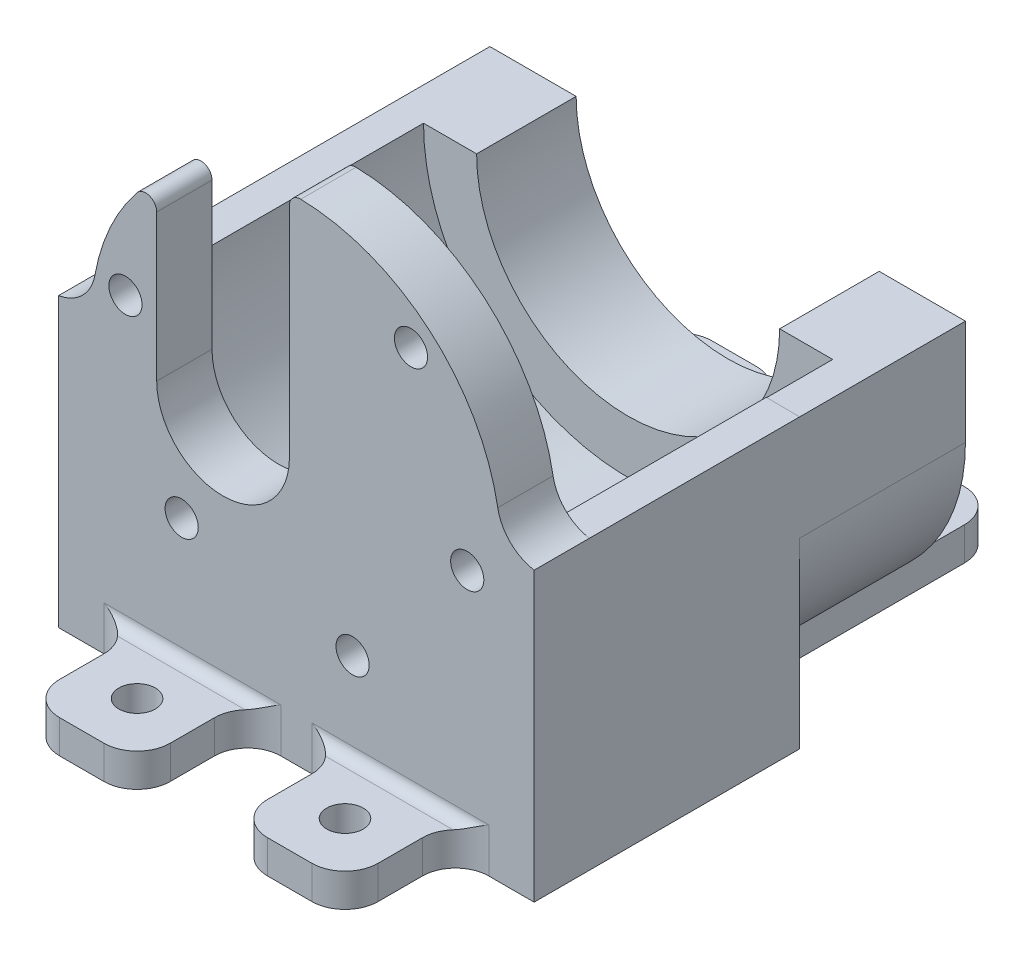
from build123d import *

# Parameters (mm, degrees)
BOSS_EXTRUDE1_DEPTH      = 9
BOSS_EXTRUDE2_DEPTH      = 25
FILLET1_R                = 16.5
BOSS_EXTRUDE3_START      = -34
SKETCH4_W                = 10
SKETCH4_H                = 3
BOSS_EXTRUDE3_DEPTH      = 44
SKETCH5_R                = 1.65
CUT_EXTRUDE1_DEPTH       = 3
FILLET2_R                = 3
SKETCH12_R               = 18.5
SKETCH12_R_2             = 1.5
SKETCH12_R_3             = 6
BOSS_EXTRUDE8_DEPTH      = 5
BOSS_EXTRUDE9_DEPTH      = 5
BOSS_EXTRUDE9_DEPTH_BACK = 19
SKETCH14_R               = 1.65
BOSS_EXTRUDE11_DEPTH     = 3
CUT_EXTRUDE2_START       = -6
CUT_EXTRUDE2_DEPTH       = 6
FILLET4_R                = 1
FILLET5_START            = -13
FILLET5_DEPTH            = 6
FILLET5_2_DEPTH          = 4
FILLET5_START_2          = -18
FILLET5_3_DEPTH          = 36
FILLET6_R                = 4


with BuildPart() as part:
    # Sketch1 → Boss-Extrude1 (new body)
    with BuildSketch(Plane.XY):
        with BuildLine():
            Line((13.7, 13), (21.5, 13))
            Line((21.5, 13), (21.5, -13))
            Line((21.5, -13), (-21.5, -13))
            Line((-21.5, -13), (-21.5, 13))
            Line((-21.5, 13), (-13.7, 13))
            ThreePointArc((-13.7, 13), (0, -0.7), (13.7, 13))
        make_face()
    extrude(amount=BOSS_EXTRUDE1_DEPTH)

    # Sketch2 → Boss-Extrude2 (add)
    with BuildSketch(Plane.XY.offset(9)):
        with BuildLine():
            Line((18.5, 13), (21.5, 13))
            Line((21.5, 13), (21.5, -13))
            Line((21.5, -13), (-21.5, -13))
            Line((-21.5, -13), (-21.5, 13))
            Line((-21.5, 13), (-18.5, 13))
            ThreePointArc((-18.5, 13), (0, -5.5), (18.5, 13))
        make_face()
    extrude(amount=BOSS_EXTRUDE2_DEPTH)

    # Fillet1
    fillet1_edges = [part.edges().sort_by_distance(p)[0] for p in [
        (21.5, -13, 17),
        (-21.5, -13, 17),
    ]]
    fillet(fillet1_edges, radius=FILLET1_R)

    # Sketch4 → Boss-Extrude3 (add)
    with BuildSketch(Plane(origin=(0, 0, 0), x_dir=(-1, 0, 0), z_dir=(0, 0, -1)).offset(BOSS_EXTRUDE3_START)):
        with Locations((-9.4, -11.5)):
            Rectangle(SKETCH4_W, SKETCH4_H)
        with Locations((9.4, -11.5)):
            Rectangle(SKETCH4_W, SKETCH4_H)
    extrude(amount=BOSS_EXTRUDE3_DEPTH)

    # Sketch5 → Cut-Extrude1 (cut)
    with BuildSketch(Plane(origin=(0, -10, 0), x_dir=(1, 0, 0), z_dir=(0, 1, 0))):
        with Locations(Location((9.4, 5, 0), (0, 0, 180))):
            Circle(SKETCH5_R)
        with Locations(Location((-9.4, 5, 0), (0, 0, 270))):
            Circle(SKETCH5_R)
    extrude(amount=-CUT_EXTRUDE1_DEPTH, mode=Mode.SUBTRACT)

    # Fillet2
    fillet2_edges = [part.edges().sort_by_distance(p)[0] for p in [
        (4.4, -11.5, 0),
        (9.4, -10, 0),
        (14.4, -11.5, -10),
        (4.4, -11.5, -10),
        (-9.4, -10, 0),
        (-4.4, -11.5, 0),
        (-14.4, -11.5, -10),
        (-4.4, -11.5, -10),
    ]]
    fillet(fillet2_edges, radius=FILLET2_R)



with BuildPart() as body_2:
    # Sketch12 → Boss-Extrude8 (new body)
    with BuildSketch(Plane.XY.offset(34)):
        with Locations((0, 13)):
            Circle(SKETCH12_R)
        with Locations((-15.451860729, 16.05)):
            Circle(SKETCH12_R_2, mode=Mode.SUBTRACT)
        with Locations((-5.084552883, 27.906703927)):
            Circle(SKETCH12_R_2, mode=Mode.SUBTRACT)
        with Locations((10.367307846, 24.856703927)):
            Circle(SKETCH12_R_2, mode=Mode.SUBTRACT)
        with Locations((15.451860729, 9.95)):
            Circle(SKETCH12_R_2, mode=Mode.SUBTRACT)
        with Locations((5.084552883, -1.906703927)):
            Circle(SKETCH12_R_2, mode=Mode.SUBTRACT)
        with Locations((-10.367307846, 1.143296073)):
            Circle(SKETCH12_R_2, mode=Mode.SUBTRACT)
        with Locations((-6.625133961, 10.74)):
            Circle(SKETCH12_R_3, mode=Mode.SUBTRACT)
    extrude(amount=BOSS_EXTRUDE8_DEPTH)


with BuildPart() as part_1:
    add(part.part)

    add(body_2.part)  # Boss-Extrude9 merges body 2
    # Sketch13 → Boss-Extrude9 (add, two sides: drawn at the far end of the back side and taken through both)
    with BuildSketch(Plane.XY.offset(34).offset(-BOSS_EXTRUDE9_DEPTH_BACK)):
        with BuildLine():
            Line((-21.5, 13), (-21.5, -13))
            Line((-21.5, -13), (21.5, -13))
            Line((21.5, -13), (21.5, 13))
            Line((21.5, 13), (18.496156013, 13.034404843))
            Line((18.496156013, 13.034404843), (18.5, 13))
            ThreePointArc((18.5, 13), (0, -5.5), (-18.5, 13))
            Line((-18.5, 13), (-21.5, 13))
        make_face()
    extrude(amount=BOSS_EXTRUDE9_DEPTH + BOSS_EXTRUDE9_DEPTH_BACK)

    # Sketch14 → Boss-Extrude11 (add)
    # profile 1 of 2: a face of its own
    with BuildSketch(Plane.XZ.offset(13)):
        with BuildLine():
            Line((7.4, 49), (11.4, 49))
            ThreePointArc((11.4, 49), (13.521320344, 48.121320344), (14.4, 46))
            Line((14.4, 46), (14.4, 39))
            Line((14.4, 39), (4.4, 39))
            Line((4.4, 39), (4.4, 46))
            ThreePointArc((4.4, 46), (5.278679656, 48.121320344), (7.4, 49))
        make_face()
        with Locations(Location((9.4, 44, 0), (0, 0, 180))):
            Circle(SKETCH14_R, mode=Mode.SUBTRACT)
    # profile 2 of 2: a face of its own
    with BuildSketch(Plane.XZ.offset(13)):
        with BuildLine():
            Line((-7.4, 49), (-11.4, 49))
            ThreePointArc((-11.4, 49), (-13.521320344, 48.121320344), (-14.4, 46))
            Line((-14.4, 46), (-14.4, 39))
            Line((-14.4, 39), (-4.4, 39))
            Line((-4.4, 39), (-4.4, 46))
            ThreePointArc((-4.4, 46), (-5.278679656, 48.121320344), (-7.4, 49))
        make_face()
        with Locations(Location((-9.4, 44, 0), (0, 0, 180))):
            Circle(SKETCH14_R, mode=Mode.SUBTRACT)
    extrude(amount=-BOSS_EXTRUDE11_DEPTH)

    # Sketch15 → Cut-Extrude2 (cut)
    with BuildSketch(Plane.XY.offset(39).offset(CUT_EXTRUDE2_START)):
        with BuildLine():
            Line((-12.625133961, 10.74), (-12.625133961, 26.522425539))
            ThreePointArc((-12.625133961, 26.522425539), (-7.075323018, 30.093560314), (-0.625133961, 31.489435025))
            Line((-0.625133961, 31.489435025), (-0.625133961, 10.74))
            ThreePointArc((-0.625133961, 10.74), (-6.625133961, 4.74), (-12.625133961, 10.74))
        make_face()
    extrude(amount=CUT_EXTRUDE2_DEPTH, mode=Mode.SUBTRACT)

    # Fillet4
    fillet4_edges = [part_1.edges().sort_by_distance(p)[0] for p in [
        (-9.4, -10, 39),
        (9.4, -10, 39),
        (-12.625133961, 26.522425539, 36.5),
        (-0.625133961, 31.489435025, 36.5),
    ]]
    fillet(fillet4_edges, radius=FILLET4_R)

    # Fillet5: read off the stored shape, not the designer's step
    # Fillet5 outline → Fillet5 (add)
    with BuildSketch(Plane(origin=(0, 0, 0), x_dir=(1, 0, 0), z_dir=(0, 1, 0)).offset(FILLET5_START)):
        with BuildLine():
            ThreePointArc((-14.4, -12), (-15.278679656, -14.121320344), (-17.4, -15))
            Line((-17.4, -15), (-14.4, -15))
            Line((-14.4, -15), (-14.4, -12))
        make_face()
        with BuildLine():
            Line((14.4, -15), (17.4, -15))
            ThreePointArc((17.4, -15), (15.278679656, -14.121320344), (14.4, -12))
            Line((14.4, -12), (14.4, -15))
        make_face()
    extrude(amount=FILLET5_DEPTH)

    # Fillet5 2 outline → Fillet5 2 (add)
    with BuildSketch(Plane(origin=(0, 0, 0), x_dir=(1, 0, 0), z_dir=(0, 1, 0)).offset(FILLET5_START)):
        with BuildLine():
            Line((14.4, -39), (14.4, -42))
            ThreePointArc((14.4, -42), (15.278679656, -39.878679656), (17.4, -39))
            Line((17.4, -39), (14.4, -39))
        make_face()
        with BuildLine():
            Line((-14.4, -42), (-14.4, -39))
            Line((-14.4, -39), (-17.4, -39))
            ThreePointArc((-17.4, -39), (-15.278679656, -39.878679656), (-14.4, -42))
        make_face()
        with BuildLine():
            ThreePointArc((-4.4, -42), (-3.521320344, -39.878679656), (-1.4, -39))
            Line((-1.4, -39), (-4.4, -39))
            Line((-4.4, -39), (-4.4, -42))
        make_face()
        with BuildLine():
            Line((4.4, -42), (4.4, -39))
            Line((4.4, -39), (1.4, -39))
            ThreePointArc((1.4, -39), (3.521320344, -39.878679656), (4.4, -42))
        make_face()
    extrude(amount=FILLET5_2_DEPTH)

    # Fillet5 3 outline → Fillet5 3 (cut)
    with BuildSketch(Plane.YZ.offset(FILLET5_START_2)):
        with BuildLine():
            Line((-9, 42), (-10, 42))
            Line((-10, 42), (-10, 40))
            ThreePointArc((-10, 40), (-9.707106781, 39.292893219), (-9, 39))
            Line((-9, 39), (-9, 42))
        make_face()
    extrude(amount=FILLET5_3_DEPTH, mode=Mode.SUBTRACT)

    # Fillet6
    # the kernel refuses this fillet: 4 mm, written as the material it adds along each edge
    with BuildSketch(Plane(origin=(-18.5, 13, 39), x_dir=(-1, 0, 0), z_dir=(0, 0, -1))) as fillet6_piece_1:
        with BuildLine():
            CenterArc((3.651162791, 3.9466425), FILLET6_R, 190.102305056, 70.528779366)
            ThreePointArc((-0.286821705, 3.245017166), (-0.071844932, 1.628834177), (0, 0))
            Line((0, 0), (3, 0))
        make_face()
    extrude(amount=5)
    with BuildSketch(Plane(origin=(18.499968089, 13.034361181, 39), x_dir=(-0.08897012709688518, 0.996034294833448, 0), z_dir=(0, 0, -1))) as fillet6_piece_2:
        with BuildLine():
            CenterArc((3.571919108, 3.984791306), FILLET6_R, 194.473277614, 70.528779366)
            Line((-0.301138135, 2.98507755), (0, 0))
            ThreePointArc((0, 0), (1.611719597, 0.070340211), (3.223439195, 0))
        make_face()
    extrude(amount=5)


solid = part_1.part
